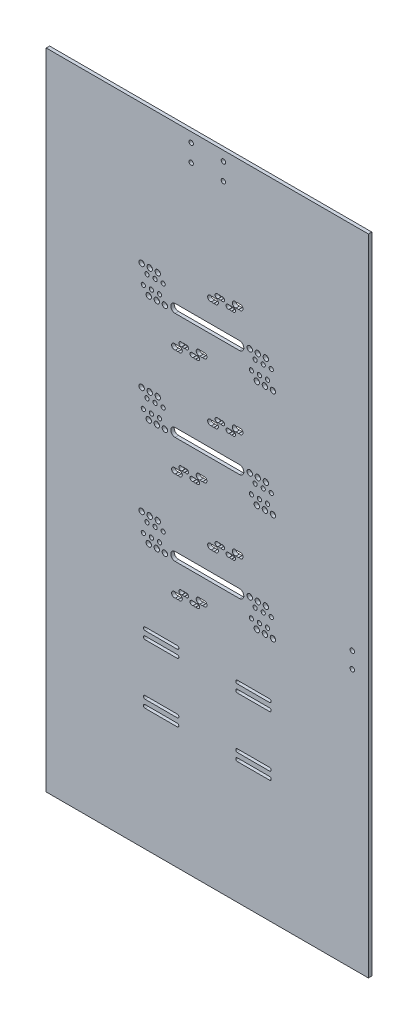
from build123d import *

# Parameters (mm, degrees)
SKETCH1_W           = 300
SKETCH1_H           = 600
BOSS_EXTRUDE1_DEPTH = 3.175
CUT_EXTRUDE1_DEPTH  = 10
SKETCH5_R           = 2.5
SKETCH5_R_2         = 1.95
CUT_EXTRUDE4_DEPTH  = 10
SKETCH6_R           = 2.05
CUT_EXTRUDE5_DEPTH  = 51
CUT_EXTRUDE6_DEPTH  = 51
SKETCH8_R           = 2.1
CUT_EXTRUDE7_DEPTH  = 67


with BuildPart() as part:
    # Sketch1 → Boss-Extrude1 (new body)
    with BuildSketch(Plane.XY):
        with Locations((-15.986837609, 103.602194644)):
            Rectangle(SKETCH1_W, SKETCH1_H)
    extrude(amount=BOSS_EXTRUDE1_DEPTH)

    # Sketch4 → Cut-Extrude1 (cut)
    with BuildSketch(Plane.XY.offset(3.175)):
        with BuildLine():
            Line((-45.986837609, 257.602194644), (14.013162391, 257.602194644))
            ThreePointArc((14.013162391, 257.602194644), (18.013162391, 253.602194644), (14.013162391, 249.602194644))
            Line((14.013162391, 249.602194644), (-45.986837609, 249.602194644))
            ThreePointArc((-45.986837609, 249.602194644), (-49.986837609, 253.602194644), (-45.986837609, 257.602194644))
        make_face()
        with BuildLine():
            Line((-45.986837609, 157.602194644), (14.013162391, 157.602194644))
            ThreePointArc((14.013162391, 157.602194644), (18.013162391, 153.602194644), (14.013162391, 149.602194644))
            Line((14.013162391, 149.602194644), (-45.986837609, 149.602194644))
            ThreePointArc((-45.986837609, 149.602194644), (-49.986837609, 153.602194644), (-45.986837609, 157.602194644))
        make_face()
        with BuildLine():
            Line((-45.986837609, 57.602194644), (14.013162391, 57.602194644))
            ThreePointArc((14.013162391, 57.602194644), (18.013162391, 53.602194644), (14.013162391, 49.602194644))
            Line((14.013162391, 49.602194644), (-45.986837609, 49.602194644))
            ThreePointArc((-45.986837609, 49.602194644), (-49.986837609, 53.602194644), (-45.986837609, 57.602194644))
        make_face()
    extrude(amount=-CUT_EXTRUDE1_DEPTH, mode=Mode.SUBTRACT)

    # Sketch5 → Cut-Extrude4 (cut)
    with BuildSketch(Plane(origin=(0, 0, 0), x_dir=(-1, 0, 0), z_dir=(0, 0, -1))):
        with Locations((-30.126255431, 32.82022594)):
            Circle(SKETCH5_R)
        with Locations((-37.626255431, 32.82022594)):
            Circle(SKETCH5_R)
        with Locations((-45.126255431, 32.82022594)):
            Circle(SKETCH5_R)
        with Locations((-32.60242235, 39.116594733)):
            Circle(SKETCH5_R_2)
        with Locations((-25.10242235, 39.116594733)):
            Circle(SKETCH5_R_2)
        with Locations((-40.10242235, 39.116594733)):
            Circle(SKETCH5_R_2)
        with Locations((-36.067244746, 49.474446333)):
            Circle(SKETCH5_R_2)
        with Locations((-28.567244746, 49.474446333)):
            Circle(SKETCH5_R_2)
        with Locations((-43.567244746, 49.474446333)):
            Circle(SKETCH5_R_2)
        with Locations((-38.543411665, 55.770815126)):
            Circle(SKETCH5_R)
        with Locations((-31.043411665, 55.770815126)):
            Circle(SKETCH5_R)
        with Locations((-23.543411665, 55.770815126)):
            Circle(SKETCH5_R)
        with Locations((62.09993065, 74.384163348)):
            Circle(SKETCH5_R)
        with Locations((69.59993065, 74.384163348)):
            Circle(SKETCH5_R)
        with Locations((77.09993065, 74.384163348)):
            Circle(SKETCH5_R)
        with Locations((57.076097569, 68.087794555)):
            Circle(SKETCH5_R_2)
        with Locations((64.576097569, 68.087794555)):
            Circle(SKETCH5_R_2)
        with Locations((72.076097569, 68.087794555)):
            Circle(SKETCH5_R_2)
        with Locations((60.540919965, 57.729942956)):
            Circle(SKETCH5_R_2)
        with Locations((68.040919965, 57.729942956)):
            Circle(SKETCH5_R_2)
        with Locations((75.540919965, 57.729942956)):
            Circle(SKETCH5_R_2)
        with Locations((70.517086884, 51.433574163)):
            Circle(SKETCH5_R)
        with Locations((63.017086884, 51.433574163)):
            Circle(SKETCH5_R)
        with Locations((55.517086884, 51.433574163)):
            Circle(SKETCH5_R)
        with Locations((-30.126255431, 132.82022594)):
            Circle(SKETCH5_R)
        with Locations((-37.626255431, 132.82022594)):
            Circle(SKETCH5_R)
        with Locations((-45.126255431, 132.82022594)):
            Circle(SKETCH5_R)
        with Locations((-32.60242235, 139.116594733)):
            Circle(SKETCH5_R_2)
        with Locations((-25.10242235, 139.116594733)):
            Circle(SKETCH5_R_2)
        with Locations((-40.10242235, 139.116594733)):
            Circle(SKETCH5_R_2)
        with Locations((-36.067244746, 149.474446333)):
            Circle(SKETCH5_R_2)
        with Locations((-28.567244746, 149.474446333)):
            Circle(SKETCH5_R_2)
        with Locations((-43.567244746, 149.474446333)):
            Circle(SKETCH5_R_2)
        with Locations((-38.543411665, 155.770815126)):
            Circle(SKETCH5_R)
        with Locations((-31.043411665, 155.770815126)):
            Circle(SKETCH5_R)
        with Locations((-23.543411665, 155.770815126)):
            Circle(SKETCH5_R)
        with Locations((62.09993065, 174.384163348)):
            Circle(SKETCH5_R)
        with Locations((69.59993065, 174.384163348)):
            Circle(SKETCH5_R)
        with Locations((77.09993065, 174.384163348)):
            Circle(SKETCH5_R)
        with Locations((57.076097569, 168.087794555)):
            Circle(SKETCH5_R_2)
        with Locations((64.576097569, 168.087794555)):
            Circle(SKETCH5_R_2)
        with Locations((72.076097569, 168.087794555)):
            Circle(SKETCH5_R_2)
        with Locations((60.540919965, 157.729942956)):
            Circle(SKETCH5_R_2)
        with Locations((68.040919965, 157.729942956)):
            Circle(SKETCH5_R_2)
        with Locations((75.540919965, 157.729942956)):
            Circle(SKETCH5_R_2)
        with Locations((70.517086884, 151.433574163)):
            Circle(SKETCH5_R)
        with Locations((63.017086884, 151.433574163)):
            Circle(SKETCH5_R)
        with Locations((55.517086884, 151.433574163)):
            Circle(SKETCH5_R)
        with Locations((-30.126255431, 232.82022594)):
            Circle(SKETCH5_R)
        with Locations((-37.626255431, 232.82022594)):
            Circle(SKETCH5_R)
        with Locations((-45.126255431, 232.82022594)):
            Circle(SKETCH5_R)
        with Locations((-32.60242235, 239.116594733)):
            Circle(SKETCH5_R_2)
        with Locations((-25.10242235, 239.116594733)):
            Circle(SKETCH5_R_2)
        with Locations((-40.10242235, 239.116594733)):
            Circle(SKETCH5_R_2)
        with Locations((-36.067244746, 249.474446333)):
            Circle(SKETCH5_R_2)
        with Locations((-28.567244746, 249.474446333)):
            Circle(SKETCH5_R_2)
        with Locations((-43.567244746, 249.474446333)):
            Circle(SKETCH5_R_2)
        with Locations((-38.543411665, 255.770815126)):
            Circle(SKETCH5_R)
        with Locations((-31.043411665, 255.770815126)):
            Circle(SKETCH5_R)
        with Locations((-23.543411665, 255.770815126)):
            Circle(SKETCH5_R)
        with Locations((62.09993065, 274.384163348)):
            Circle(SKETCH5_R)
        with Locations((69.59993065, 274.384163348)):
            Circle(SKETCH5_R)
        with Locations((77.09993065, 274.384163348)):
            Circle(SKETCH5_R)
        with Locations((57.076097569, 268.087794555)):
            Circle(SKETCH5_R_2)
        with Locations((64.576097569, 268.087794555)):
            Circle(SKETCH5_R_2)
        with Locations((72.076097569, 268.087794555)):
            Circle(SKETCH5_R_2)
        with Locations((60.540919965, 257.729942956)):
            Circle(SKETCH5_R_2)
        with Locations((68.040919965, 257.729942956)):
            Circle(SKETCH5_R_2)
        with Locations((75.540919965, 257.729942956)):
            Circle(SKETCH5_R_2)
        with Locations((70.517086884, 251.433574163)):
            Circle(SKETCH5_R)
        with Locations((63.017086884, 251.433574163)):
            Circle(SKETCH5_R)
        with Locations((55.517086884, 251.433574163)):
            Circle(SKETCH5_R)
        with BuildLine():
            ThreePointArc((-11.035122677, 86.887033976), (-12.285122677, 87.221970467), (-13.535122677, 86.887033976))
            ThreePointArc((-13.535122677, 86.887033976), (-17.285122677, 84.721970467), (-13.535122677, 82.556906957))
            ThreePointArc((-13.535122677, 82.556906957), (-12.285122677, 82.221970467), (-11.035122677, 82.556906957))
            ThreePointArc((-11.035122677, 82.556906957), (-7.285122677, 84.721970467), (-11.035122677, 86.887033976))
        make_face()
        with BuildLine():
            ThreePointArc((20.06032723, 26.907580641), (21.31032723, 26.572644151), (22.56032723, 26.907580641))
            ThreePointArc((22.56032723, 26.907580641), (26.31032723, 29.072644151), (22.56032723, 31.23770766))
            ThreePointArc((22.56032723, 31.23770766), (21.31032723, 31.572644151), (20.06032723, 31.23770766))
            ThreePointArc((20.06032723, 31.23770766), (16.31032723, 29.072644151), (20.06032723, 26.907580641))
        make_face()
        with BuildLine():
            ThreePointArc((26.355079811, 25.543449103), (23.155079811, 24.046786149), (26.355079811, 22.550123194))
            ThreePointArc((26.355079811, 22.550123194), (27.605079811, 22.096786149), (28.855079811, 22.550123194))
            ThreePointArc((28.855079811, 22.550123194), (32.055079811, 24.046786149), (28.855079811, 25.543449103))
            ThreePointArc((28.855079811, 25.543449103), (27.605079811, 25.996786149), (26.355079811, 25.543449103))
        make_face()
        with BuildLine():
            ThreePointArc((39.214045315, 26.011613861), (42.414045315, 27.508276815), (39.214045315, 29.00493977))
            ThreePointArc((39.214045315, 29.00493977), (37.964045315, 29.458276815), (36.714045315, 29.00493977))
            ThreePointArc((36.714045315, 29.00493977), (33.514045315, 27.508276815), (36.714045315, 26.011613861))
            ThreePointArc((36.714045315, 26.011613861), (37.964045315, 25.558276815), (39.214045315, 26.011613861))
        make_face()
        with BuildLine():
            ThreePointArc((43.008797896, 24.647482322), (39.258797896, 22.482418813), (43.008797896, 20.317355304))
            ThreePointArc((43.008797896, 20.317355304), (44.258797896, 19.982418813), (45.508797896, 20.317355304))
            ThreePointArc((45.508797896, 20.317355304), (49.258797896, 22.482418813), (45.508797896, 24.647482322))
            ThreePointArc((45.508797896, 24.647482322), (44.258797896, 24.982418813), (43.008797896, 24.647482322))
        make_face()
        with BuildLine():
            ThreePointArc((-7.240370096, 81.192775404), (-10.440370091, 79.696112456), (-7.240370096, 78.199449508))
            ThreePointArc((-7.240370096, 78.199449508), (-5.990370095, 77.746112461), (-4.740370094, 78.199449509))
            ThreePointArc((-4.740370094, 78.199449509), (-1.540370099, 79.696112464), (-4.7403701, 81.192775407))
            ThreePointArc((-4.7403701, 81.192775407), (-5.990370098, 81.646112451), (-7.240370096, 81.192775404))
        make_face()
        with BuildLine():
            ThreePointArc((3.118595408, 84.654266079), (-0.081404587, 83.157603131), (3.118595408, 81.660940183))
            ThreePointArc((3.118595408, 81.660940183), (4.368595408, 81.207603136), (5.618595408, 81.660940183))
            ThreePointArc((5.618595408, 81.660940183), (8.818595403, 83.157603131), (5.618595408, 84.654266079))
            ThreePointArc((5.618595408, 84.654266079), (4.368595408, 85.107603126), (3.118595408, 84.654266079))
        make_face()
        with BuildLine():
            ThreePointArc((9.413347989, 80.29680863), (5.663347989, 78.13174512), (9.413347989, 75.966681611))
            ThreePointArc((9.413347989, 75.966681611), (10.663347989, 75.63174512), (11.913347989, 75.966681611))
            ThreePointArc((11.913347989, 75.966681611), (15.663347989, 78.13174512), (11.913347989, 80.29680863))
            ThreePointArc((11.913347989, 80.29680863), (10.663347989, 80.63174512), (9.413347989, 80.29680863))
        make_face()
        with BuildLine():
            ThreePointArc((-11.035122677, 186.887033976), (-12.285122677, 187.221970467), (-13.535122677, 186.887033976))
            ThreePointArc((-13.535122677, 186.887033976), (-17.285122677, 184.721970467), (-13.535122677, 182.556906957))
            ThreePointArc((-13.535122677, 182.556906957), (-12.285122677, 182.221970467), (-11.035122677, 182.556906957))
            ThreePointArc((-11.035122677, 182.556906957), (-7.285122677, 184.721970467), (-11.035122677, 186.887033976))
        make_face()
        with BuildLine():
            ThreePointArc((20.06032723, 126.907580641), (21.31032723, 126.572644151), (22.56032723, 126.907580641))
            ThreePointArc((22.56032723, 126.907580641), (26.31032723, 129.072644151), (22.56032723, 131.23770766))
            ThreePointArc((22.56032723, 131.23770766), (21.31032723, 131.572644151), (20.06032723, 131.23770766))
            ThreePointArc((20.06032723, 131.23770766), (16.31032723, 129.072644151), (20.06032723, 126.907580641))
        make_face()
        with BuildLine():
            ThreePointArc((26.355079811, 125.543449103), (23.155079811, 124.046786149), (26.355079811, 122.550123194))
            ThreePointArc((26.355079811, 122.550123194), (27.605079811, 122.096786149), (28.855079811, 122.550123194))
            ThreePointArc((28.855079811, 122.550123194), (32.055079811, 124.046786149), (28.855079811, 125.543449103))
            ThreePointArc((28.855079811, 125.543449103), (27.605079811, 125.996786149), (26.355079811, 125.543449103))
        make_face()
        with BuildLine():
            ThreePointArc((39.214045315, 126.011613861), (42.414045315, 127.508276815), (39.214045315, 129.00493977))
            ThreePointArc((39.214045315, 129.00493977), (37.964045315, 129.458276815), (36.714045315, 129.00493977))
            ThreePointArc((36.714045315, 129.00493977), (33.514045315, 127.508276815), (36.714045315, 126.011613861))
            ThreePointArc((36.714045315, 126.011613861), (37.964045315, 125.558276815), (39.214045315, 126.011613861))
        make_face()
        with BuildLine():
            ThreePointArc((43.008797896, 124.647482322), (39.258797896, 122.482418813), (43.008797896, 120.317355304))
            ThreePointArc((43.008797896, 120.317355304), (44.258797896, 119.982418813), (45.508797896, 120.317355304))
            ThreePointArc((45.508797896, 120.317355304), (49.258797896, 122.482418813), (45.508797896, 124.647482322))
            ThreePointArc((45.508797896, 124.647482322), (44.258797896, 124.982418813), (43.008797896, 124.647482322))
        make_face()
        with BuildLine():
            ThreePointArc((-7.240370096, 181.192775404), (-10.440370091, 179.696112456), (-7.240370096, 178.199449508))
            ThreePointArc((-7.240370096, 178.199449508), (-5.990370095, 177.746112461), (-4.740370094, 178.199449509))
            ThreePointArc((-4.740370094, 178.199449509), (-1.540370099, 179.696112464), (-4.7403701, 181.192775407))
            ThreePointArc((-4.7403701, 181.192775407), (-5.990370098, 181.646112451), (-7.240370096, 181.192775404))
        make_face()
        with BuildLine():
            ThreePointArc((3.118595408, 184.654266079), (-0.081404587, 183.157603131), (3.118595408, 181.660940183))
            ThreePointArc((3.118595408, 181.660940183), (4.368595408, 181.207603136), (5.618595408, 181.660940183))
            ThreePointArc((5.618595408, 181.660940183), (8.818595403, 183.157603131), (5.618595408, 184.654266079))
            ThreePointArc((5.618595408, 184.654266079), (4.368595408, 185.107603126), (3.118595408, 184.654266079))
        make_face()
        with BuildLine():
            ThreePointArc((9.413347989, 180.29680863), (5.663347989, 178.13174512), (9.413347989, 175.966681611))
            ThreePointArc((9.413347989, 175.966681611), (10.663347989, 175.63174512), (11.913347989, 175.966681611))
            ThreePointArc((11.913347989, 175.966681611), (15.663347989, 178.13174512), (11.913347989, 180.29680863))
            ThreePointArc((11.913347989, 180.29680863), (10.663347989, 180.63174512), (9.413347989, 180.29680863))
        make_face()
        with BuildLine():
            ThreePointArc((-11.035122677, 286.887033976), (-12.285122677, 287.221970467), (-13.535122677, 286.887033976))
            ThreePointArc((-13.535122677, 286.887033976), (-17.285122677, 284.721970467), (-13.535122677, 282.556906957))
            ThreePointArc((-13.535122677, 282.556906957), (-12.285122677, 282.221970467), (-11.035122677, 282.556906957))
            ThreePointArc((-11.035122677, 282.556906957), (-7.285122677, 284.721970467), (-11.035122677, 286.887033976))
        make_face()
        with BuildLine():
            ThreePointArc((20.06032723, 226.907580641), (21.31032723, 226.572644151), (22.56032723, 226.907580641))
            ThreePointArc((22.56032723, 226.907580641), (26.31032723, 229.072644151), (22.56032723, 231.23770766))
            ThreePointArc((22.56032723, 231.23770766), (21.31032723, 231.572644151), (20.06032723, 231.23770766))
            ThreePointArc((20.06032723, 231.23770766), (16.31032723, 229.072644151), (20.06032723, 226.907580641))
        make_face()
        with BuildLine():
            ThreePointArc((26.355079811, 225.543449103), (23.155079811, 224.046786149), (26.355079811, 222.550123194))
            ThreePointArc((26.355079811, 222.550123194), (27.605079811, 222.096786149), (28.855079811, 222.550123194))
            ThreePointArc((28.855079811, 222.550123194), (32.055079811, 224.046786149), (28.855079811, 225.543449103))
            ThreePointArc((28.855079811, 225.543449103), (27.605079811, 225.996786149), (26.355079811, 225.543449103))
        make_face()
        with BuildLine():
            ThreePointArc((39.214045315, 226.011613861), (42.414045315, 227.508276815), (39.214045315, 229.00493977))
            ThreePointArc((39.214045315, 229.00493977), (37.964045315, 229.458276815), (36.714045315, 229.00493977))
            ThreePointArc((36.714045315, 229.00493977), (33.514045315, 227.508276815), (36.714045315, 226.011613861))
            ThreePointArc((36.714045315, 226.011613861), (37.964045315, 225.558276815), (39.214045315, 226.011613861))
        make_face()
        with BuildLine():
            ThreePointArc((43.008797896, 224.647482322), (39.258797896, 222.482418813), (43.008797896, 220.317355304))
            ThreePointArc((43.008797896, 220.317355304), (44.258797896, 219.982418813), (45.508797896, 220.317355304))
            ThreePointArc((45.508797896, 220.317355304), (49.258797896, 222.482418813), (45.508797896, 224.647482322))
            ThreePointArc((45.508797896, 224.647482322), (44.258797896, 224.982418813), (43.008797896, 224.647482322))
        make_face()
        with BuildLine():
            ThreePointArc((-7.240370096, 281.192775404), (-10.440370091, 279.696112456), (-7.240370096, 278.199449508))
            ThreePointArc((-7.240370096, 278.199449508), (-5.990370095, 277.746112461), (-4.740370094, 278.199449509))
            ThreePointArc((-4.740370094, 278.199449509), (-1.540370099, 279.696112464), (-4.7403701, 281.192775407))
            ThreePointArc((-4.7403701, 281.192775407), (-5.990370098, 281.646112451), (-7.240370096, 281.192775404))
        make_face()
        with BuildLine():
            ThreePointArc((3.118595408, 284.654266079), (-0.081404587, 283.157603131), (3.118595408, 281.660940183))
            ThreePointArc((3.118595408, 281.660940183), (4.368595408, 281.207603136), (5.618595408, 281.660940183))
            ThreePointArc((5.618595408, 281.660940183), (8.818595403, 283.157603131), (5.618595408, 284.654266079))
            ThreePointArc((5.618595408, 284.654266079), (4.368595408, 285.107603126), (3.118595408, 284.654266079))
        make_face()
        with BuildLine():
            ThreePointArc((9.413347989, 280.29680863), (5.663347989, 278.13174512), (9.413347989, 275.966681611))
            ThreePointArc((9.413347989, 275.966681611), (10.663347989, 275.63174512), (11.913347989, 275.966681611))
            ThreePointArc((11.913347989, 275.966681611), (15.663347989, 278.13174512), (11.913347989, 280.29680863))
            ThreePointArc((11.913347989, 280.29680863), (10.663347989, 280.63174512), (9.413347989, 280.29680863))
        make_face()
    extrude(amount=-CUT_EXTRUDE4_DEPTH, mode=Mode.SUBTRACT)

    # Sketch6 → Cut-Extrude5 (cut)
    with BuildSketch(Plane(origin=(0, 0, 0), x_dir=(-1, 0, 0), z_dir=(0, 0, -1))):
        with Locations((0.986837609, 394.602194644)):
            Circle(SKETCH6_R)
        with Locations((30.986837609, 394.602194644)):
            Circle(SKETCH6_R)
        with Locations((30.986837609, 378.602194644)):
            Circle(SKETCH6_R)
        with Locations((0.986837609, 378.602194644)):
            Circle(SKETCH6_R)
    extrude(amount=-CUT_EXTRUDE5_DEPTH, mode=Mode.SUBTRACT)

    # Sketch7 → Cut-Extrude6 (cut)
    with BuildSketch(Plane(origin=(0, 0, 0), x_dir=(-1, 0, 0), z_dir=(0, 0, -1))):
        with BuildLine():
            Line((-42.013162391, -24.550253951), (-12.013162391, -24.550253951))
            ThreePointArc((-12.013162391, -24.550253951), (-10.513162391, -26.050253951), (-12.013162391, -27.550253951))
            Line((-12.013162391, -27.550253951), (-42.013162391, -27.550253951))
            ThreePointArc((-42.013162391, -27.550253951), (-43.513162391, -26.050253951), (-42.013162391, -24.550253951))
        make_face()
        with BuildLine():
            Line((-42.013162391, -17.24179585), (-12.013162391, -17.24179585))
            ThreePointArc((-12.013162391, -17.24179585), (-10.513162391, -18.74179585), (-12.013162391, -20.24179585))
            Line((-12.013162391, -20.24179585), (-42.013162391, -20.24179585))
            ThreePointArc((-42.013162391, -20.24179585), (-43.513162391, -18.74179585), (-42.013162391, -17.24179585))
        make_face()
        with BuildLine():
            Line((43.986837609, -24.550253951), (73.986837609, -24.550253951))
            ThreePointArc((73.986837609, -24.550253951), (75.486837609, -26.050253951), (73.986837609, -27.550253951))
            Line((73.986837609, -27.550253951), (43.986837609, -27.550253951))
            ThreePointArc((43.986837609, -27.550253951), (42.486837609, -26.050253951), (43.986837609, -24.550253951))
        make_face()
        with BuildLine():
            Line((43.986837609, -17.24179585), (73.986837609, -17.24179585))
            ThreePointArc((73.986837609, -17.24179585), (75.486837609, -18.74179585), (73.986837609, -20.24179585))
            Line((73.986837609, -20.24179585), (43.986837609, -20.24179585))
            ThreePointArc((43.986837609, -20.24179585), (42.486837609, -18.74179585), (43.986837609, -17.24179585))
        make_face()
        with BuildLine():
            Line((43.986837609, -79.858712053), (73.986837609, -79.858712053))
            ThreePointArc((73.986837609, -79.858712053), (75.486837609, -81.358712053), (73.986837609, -82.858712053))
            Line((73.986837609, -82.858712053), (43.986837609, -82.858712053))
            ThreePointArc((43.986837609, -82.858712053), (42.486837609, -81.358712053), (43.986837609, -79.858712053))
        make_face()
        with BuildLine():
            Line((43.986837609, -72.550253951), (73.986837609, -72.550253951))
            ThreePointArc((73.986837609, -72.550253951), (75.486837609, -74.050253951), (73.986837609, -75.550253951))
            Line((73.986837609, -75.550253951), (43.986837609, -75.550253951))
            ThreePointArc((43.986837609, -75.550253951), (42.486837609, -74.050253951), (43.986837609, -72.550253951))
        make_face()
        with BuildLine():
            Line((-42.013162391, -79.858712053), (-12.013162391, -79.858712053))
            ThreePointArc((-12.013162391, -79.858712053), (-10.513162391, -81.358712053), (-12.013162391, -82.858712053))
            Line((-12.013162391, -82.858712053), (-42.013162391, -82.858712053))
            ThreePointArc((-42.013162391, -82.858712053), (-43.513162391, -81.358712053), (-42.013162391, -79.858712053))
        make_face()
        with BuildLine():
            Line((-42.013162391, -72.550253951), (-12.013162391, -72.550253951))
            ThreePointArc((-12.013162391, -72.550253951), (-10.513162391, -74.050253951), (-12.013162391, -75.550253951))
            Line((-12.013162391, -75.550253951), (-42.013162391, -75.550253951))
            ThreePointArc((-42.013162391, -75.550253951), (-43.513162391, -74.050253951), (-42.013162391, -72.550253951))
        make_face()
    extrude(amount=-CUT_EXTRUDE6_DEPTH, mode=Mode.SUBTRACT)

    # Sketch8 → Cut-Extrude7 (cut)
    with BuildSketch(Plane(origin=(0, 0, 0), x_dir=(-1, 0, 0), z_dir=(0, 0, -1))):
        with Locations((-119.013162391, 60.107185306)):
            Circle(SKETCH8_R)
        with Locations((-119.013162391, 45.107185306)):
            Circle(SKETCH8_R)
    extrude(amount=-CUT_EXTRUDE7_DEPTH, mode=Mode.SUBTRACT)


solid = part.part
